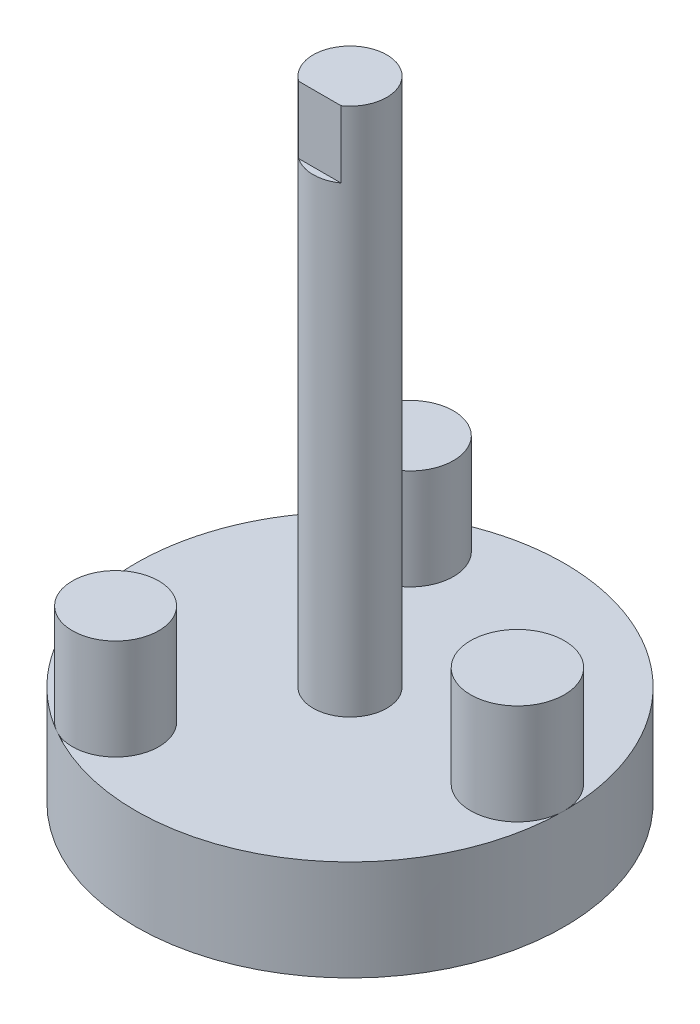
from build123d import *

# Parameters (mm, degrees)
SKETCH1_R               = 32
BOSS_EXTRUDE1_DEPTH     = 15
SKETCH2_R               = 7
SKETCH2_R_2             = 6.446135322
BOSS_EXTRUDE2_DEPTH     = 15
SKETCH3_R               = 5.5
BOSS_EXTRUDE3_DEPTH     = 79
CUT_EXTRUDE1_DEPTH      = 79
CUT_EXTRUDE1_DEPTH_BACK = 79
SKETCH4_W               = 4.257640736
SKETCH4_H               = 10


with BuildPart() as part:
    # Sketch1 → Boss-Extrude1 (new body)
    with BuildSketch(Plane(origin=(0, 0, 0), x_dir=(1, 0, 0), z_dir=(0, 1, 0))):
        Circle(SKETCH1_R)
    extrude(amount=BOSS_EXTRUDE1_DEPTH)

    # Sketch2 → Boss-Extrude2 (add)
    with BuildSketch(Plane(origin=(0, 15, 0), x_dir=(1, 0, 0), z_dir=(0, 1, 0))):
        with Locations((25, 0)):
            Circle(SKETCH2_R)
        with Locations((-13, 22)):
            Circle(SKETCH2_R_2)
        with Locations((-13, -22)):
            Circle(SKETCH2_R_2)
    extrude(amount=BOSS_EXTRUDE2_DEPTH)

    # Sketch3 → Boss-Extrude3 (add)
    with BuildSketch(Plane(origin=(0, 15, 0), x_dir=(1, 0, 0), z_dir=(0, 1, 0))):
        Circle(SKETCH3_R)
    extrude(amount=BOSS_EXTRUDE3_DEPTH)

    # Sketch4 → Cut-Extrude1 (cut, two sides: drawn at the far end of the back side and taken through both)
    with BuildSketch(Plane(origin=(0, 0, 0), x_dir=(0, 0, -1), z_dir=(1, 0, 0)).offset(-CUT_EXTRUDE1_DEPTH_BACK)):
        with Locations((-6.628820368, 89)):
            Rectangle(SKETCH4_W, SKETCH4_H)
    extrude(amount=CUT_EXTRUDE1_DEPTH + CUT_EXTRUDE1_DEPTH_BACK, mode=Mode.SUBTRACT)


solid = part.part
